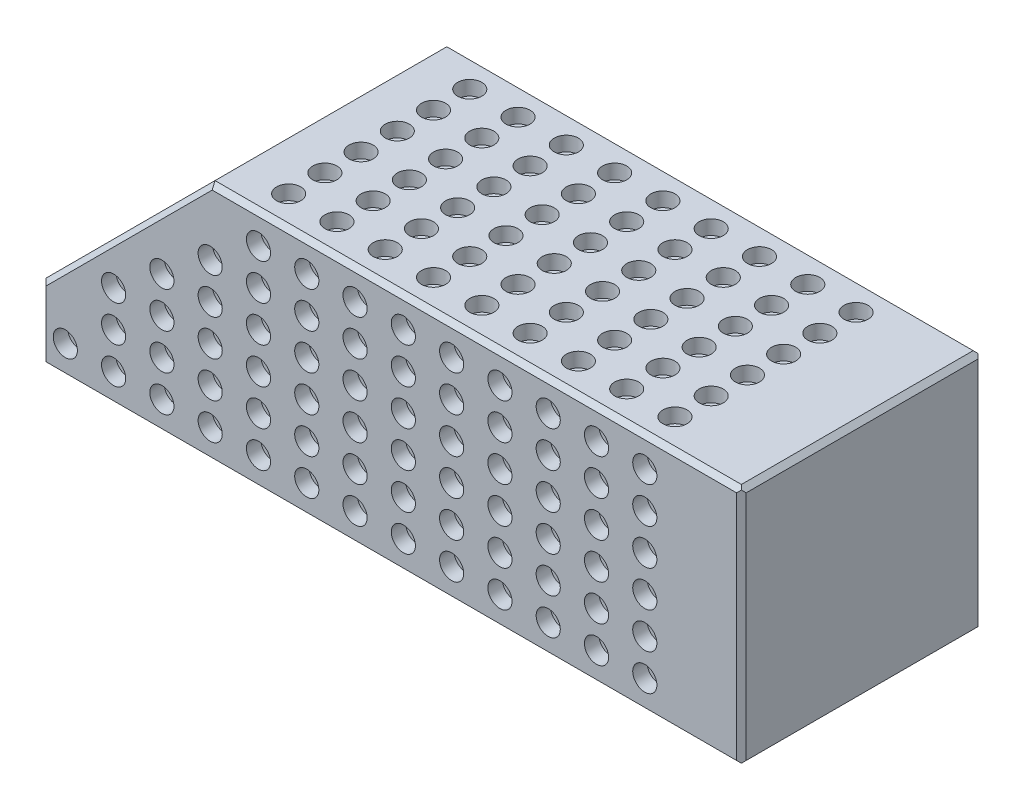
from build123d import *

# Parameters (mm, degrees)
SKETCH1_W                      = 145
SKETCH1_H                      = 50
BOSS_EXTRUDE1_DEPTH            = 25
CUT_EXTRUDE1_DEPTH             = 81.661329025
CUT_EXTRUDE1_DEPTH_BACK        = 81.661329025
F_12_0_12_DIAMETER_HOLE1_D     = 12
F_12_0_12_DIAMETER_HOLE1_DEPTH = 20.5
M10_TAPPED_HOLE2_D             = 8.5
M10_TAPPED_HOLE2_DEPTH         = 24.946342369
M10_TAPPED_HOLE2_TIP           = 2.553657631
CHAMFER1_SIZE                  = 1
CHAMFER2_SIZE                  = 1
CHAMFER3_SIZE                  = 1
SKETCH13_R                     = 2.5
CUT_EXTRUDE2_DEPTH             = 3
LPATTERN1_COUNT                = 6
LPATTERN1_PITCH                = 7.5
LPATTERN1_COUNT_DIR2           = 13
LPATTERN1_PITCH_DIR2           = 10
SKETCH14_R                     = 2.5
CUT_EXTRUDE3_DEPTH             = 3
LPATTERN2_COUNT                = 6
LPATTERN2_PITCH                = 7.5
LPATTERN2_COUNT_DIR2           = 13
LPATTERN2_PITCH_DIR2           = 10
SKETCH15_R                     = 2.5
CUT_EXTRUDE4_DEPTH             = 3
LPATTERN3_COUNT                = 6
LPATTERN3_PITCH                = 7.5
LPATTERN3_COUNT_DIR2           = 9
LPATTERN3_PITCH_DIR2           = 10
CUT_EXTRUDE5_START             = -3
SKETCH16_R                     = 2.5
CUT_EXTRUDE5_DEPTH             = 3
LPATTERN4_COUNT                = 13
LPATTERN4_PITCH                = 10
LPATTERN4_COUNT_DIR2           = 6
LPATTERN4_PITCH_DIR2           = 7.5
SKETCH17_R                     = 2.5
CUT_EXTRUDE6_DEPTH             = 3
LPATTERN5_COUNT                = 6
LPATTERN5_PITCH                = 7.5
LPATTERN5_COUNT_DIR2           = 6
LPATTERN5_PITCH_DIR2           = 7.5


with BuildPart() as part:
    # Sketch1 → Boss-Extrude1 (new, symmetric)
    with BuildSketch(Plane.XY):
        Rectangle(SKETCH1_W, SKETCH1_H)
    extrude(amount=BOSS_EXTRUDE1_DEPTH, both=True)

    # Sketch2 → Cut-Extrude1 (cut, two sides: drawn at the far end of the back side and taken through both)
    with BuildSketch(Plane.XY.offset(-CUT_EXTRUDE1_DEPTH_BACK)):
        Polygon((-72.5, -10), (-37.5, 25), (-72.5, 25), align=None)
    extrude(amount=CUT_EXTRUDE1_DEPTH + CUT_EXTRUDE1_DEPTH_BACK, mode=Mode.SUBTRACT)

    # Ø12.0 (12) Diameter Hole1
    with Locations(Plane.ZY.offset(72.5)):
        with Locations((0, -5)):
            Hole(F_12_0_12_DIAMETER_HOLE1_D / 2, depth=F_12_0_12_DIAMETER_HOLE1_DEPTH)

    # M10 Tapped Hole2
    with Locations(Plane.ZY.offset(52)):
        with Locations((0, -5)):
            Hole(M10_TAPPED_HOLE2_D / 2, depth=M10_TAPPED_HOLE2_DEPTH)
            with Locations((0, 0, -(M10_TAPPED_HOLE2_DEPTH + M10_TAPPED_HOLE2_TIP / 2))):  # 118° drill point
                Cone(0, M10_TAPPED_HOLE2_D / 2, M10_TAPPED_HOLE2_TIP, mode=Mode.SUBTRACT)

    # Chamfer1
    chamfer1_edges = [part.edges().sort_by_distance(p)[0] for p in [
        (-72.5, -17.5, -25),
        (0, -25, -25),
        (72.5, 0, -25),
        (17.5, 25, -25),
        (-55, 7.5, -25),
        (72.5, 0, 25),
        (0, -25, 25),
        (-72.5, -17.5, 25),
        (-55, 7.5, 25),
        (17.5, 25, 25),
    ]]
    chamfer(chamfer1_edges, length=CHAMFER1_SIZE)

    # Chamfer2
    chamfer2_edges = [part.edges().sort_by_distance(p)[0] for p in [
        (72.5, -25, 0),
        (72.5, 25, 0),
    ]]
    chamfer(chamfer2_edges, length=CHAMFER2_SIZE)

    # Chamfer3
    chamfer3_edges = [part.edges().sort_by_distance(p)[0] for p in [
        (-72.5, -25, 0),
    ]]
    chamfer(chamfer3_edges, length=CHAMFER3_SIZE)

    # Sketch13 → Cut-Extrude2 (cut)
    with BuildSketch(Plane.XZ.offset(25)):
        with Locations((-66.25, -18.75)):
            Circle(SKETCH13_R)
    cut_extrude2 = extrude(amount=-CUT_EXTRUDE2_DEPTH, mode=Mode.SUBTRACT)

    # LPattern1: Cut-Extrude2 6 × 13
    with Locations(*[(j * LPATTERN1_PITCH_DIR2, 0, i * LPATTERN1_PITCH) for i in range(LPATTERN1_COUNT) for j in range(LPATTERN1_COUNT_DIR2) if (i, j) != (0, 0)]):
        add(cut_extrude2, mode=Mode.SUBTRACT)

    # Sketch14 → Cut-Extrude3 (cut)
    with BuildSketch(Plane.XY.offset(25)):
        with Locations((52.5, 18.75)):
            Circle(SKETCH14_R)
    cut_extrude3 = extrude(amount=-CUT_EXTRUDE3_DEPTH, mode=Mode.SUBTRACT)

    # LPattern2: Cut-Extrude3 6 × 13, 11 skipped
    with Locations(*[(-j * LPATTERN2_PITCH_DIR2, -i * LPATTERN2_PITCH, 0) for i in range(LPATTERN2_COUNT) for j in range(LPATTERN2_COUNT_DIR2) if (i, j) not in ((0, 0), (0, 9), (0, 10), (0, 11), (0, 12), (1, 10), (1, 11), (1, 12), (2, 11), (2, 12), (3, 12), (4, 12))]):
        add(cut_extrude3, mode=Mode.SUBTRACT)

    # Sketch15 → Cut-Extrude4 (cut)
    with BuildSketch(Plane(origin=(0, 25, 0), x_dir=(1, 0, 0), z_dir=(0, 1, 0))):
        with Locations((52.5, 18.75)):
            Circle(SKETCH15_R)
    cut_extrude4 = extrude(amount=-CUT_EXTRUDE4_DEPTH, mode=Mode.SUBTRACT)

    # LPattern3: Cut-Extrude4 6 × 9
    with Locations(*[(-j * LPATTERN3_PITCH_DIR2, 0, i * LPATTERN3_PITCH) for i in range(LPATTERN3_COUNT) for j in range(LPATTERN3_COUNT_DIR2) if (i, j) != (0, 0)]):
        add(cut_extrude4, mode=Mode.SUBTRACT)

    # Sketch16 → Cut-Extrude5 (cut)
    with BuildSketch(Plane(origin=(0, 0, -25), x_dir=(-1, 0, 0), z_dir=(0, 0, -1)).offset(CUT_EXTRUDE5_START)):
        with Locations((-52.5, 18.75)):
            Circle(SKETCH16_R)
    cut_extrude5 = extrude(amount=CUT_EXTRUDE5_DEPTH, mode=Mode.SUBTRACT)

    # LPattern4: Cut-Extrude5 13 × 6, 11 skipped
    with Locations(*[(-i * LPATTERN4_PITCH, -j * LPATTERN4_PITCH_DIR2, 0) for i in range(LPATTERN4_COUNT) for j in range(LPATTERN4_COUNT_DIR2) if (i, j) not in ((0, 0), (9, 0), (10, 0), (10, 1), (11, 0), (11, 1), (11, 2), (12, 0), (12, 1), (12, 2), (12, 3), (12, 4))]):
        add(cut_extrude5, mode=Mode.SUBTRACT)

    # Sketch17 → Cut-Extrude6 (cut)
    with BuildSketch(Plane(origin=(-31.25, 31.25, 0), x_dir=(0, 0, 1), z_dir=(-0.7071067811865515, 0.7071067811865436, 0))):
        with Locations((-18.75, -16.338834765)):
            Circle(SKETCH17_R)
    cut_extrude6 = extrude(amount=-CUT_EXTRUDE6_DEPTH, mode=Mode.SUBTRACT)

    # LPattern5: Cut-Extrude6 6 × 6, 12 skipped
    with Locations(*[Vector(0, 0, 1) * (i * LPATTERN5_PITCH) + Vector(-0.7071067811865436, -0.7071067811865515, 0) * (j * LPATTERN5_PITCH_DIR2) for i in range(LPATTERN5_COUNT) for j in range(LPATTERN5_COUNT_DIR2) if (i, j) not in ((0, 0), (2, 0), (2, 1), (2, 2), (2, 3), (2, 4), (2, 5), (3, 0), (3, 1), (3, 2), (3, 3), (3, 4), (3, 5))]):
        add(cut_extrude6, mode=Mode.SUBTRACT)


solid = part.part
